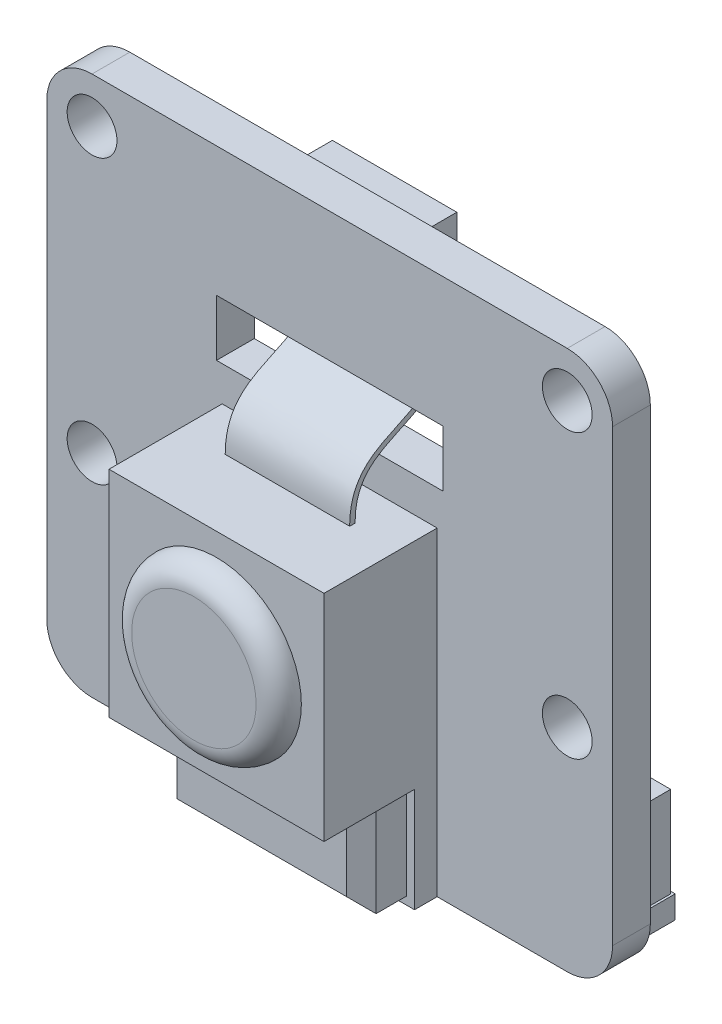
from build123d import *

# Parameters (mm, degrees)
SKETCH1_R                = 1.1
SKETCH1_W                = 10
SKETCH1_H                = 2.49
BOSS_EXTRUDE1_DEPTH      = 1.67
SKETCH2_W                = 9.5
SKETCH2_H                = 9.5
BOSS_EXTRUDE2_DEPTH      = 5
SKETCH3_R                = 3.75
BOSS_EXTRUDE3_DEPTH      = 1
FILLET1_R                = 1
SKETCH4_W                = 9.5
SKETCH4_H                = 4.61
BOSS_EXTRUDE4_DEPTH      = 1
SKETCH5_W                = 8.8
SKETCH5_H                = 3.91
BOSS_EXTRUDE5_DEPTH      = 2
CHAMFER1_SIZE            = 0.65
BOSS_EXTRUDE6_DEPTH      = 2.75
BOSS_EXTRUDE6_DEPTH_BACK = 2.75
SKETCH7_W                = 22
SKETCH7_H                = 1
BOSS_EXTRUDE7_DEPTH      = 2.6
SKETCH9_W                = 21.8
SKETCH9_H                = 4
BOSS_EXTRUDE8_DEPTH      = 2.5


with BuildPart() as part:
    # Sketch1 → Boss-Extrude1 (new body)
    with BuildSketch(Plane.XY):
        with BuildLine():
            Line((-10.5, -11.93), (10.5, -11.93))
            ThreePointArc((10.5, -11.93), (11.914213562, -11.344213562), (12.5, -9.93))
            Line((12.5, -9.93), (12.5, 9.93))
            ThreePointArc((12.5, 9.93), (11.914213562, 11.344213562), (10.5, 11.93))
            Line((10.5, 11.93), (-10.5, 11.93))
            ThreePointArc((-10.5, 11.93), (-11.914213562, 11.344213562), (-12.5, 9.93))
            Line((-12.5, 9.93), (-12.5, -9.93))
            ThreePointArc((-12.5, -9.93), (-11.914213562, -11.344213562), (-10.5, -11.93))
        make_face()
        with Locations((-10.5, 9.93)):
            Circle(SKETCH1_R, mode=Mode.SUBTRACT)
        with Locations((10.5, 9.93)):
            Circle(SKETCH1_R, mode=Mode.SUBTRACT)
        with Locations((-10.5, -2.57)):
            Circle(SKETCH1_R, mode=Mode.SUBTRACT)
        with Locations((10.5, -2.57)):
            Circle(SKETCH1_R, mode=Mode.SUBTRACT)
        with Locations((0, 4.965)):
            Rectangle(SKETCH1_W, SKETCH1_H, mode=Mode.SUBTRACT)
    extrude(amount=BOSS_EXTRUDE1_DEPTH)

    # Sketch2 → Boss-Extrude2 (add)
    with BuildSketch(Plane.XY.offset(1.67)):
        with Locations((0, -2.57)):
            Rectangle(SKETCH2_W, SKETCH2_H)
    extrude(amount=BOSS_EXTRUDE2_DEPTH)

    # Sketch3 → Boss-Extrude3 (add)
    with BuildSketch(Plane.XY.offset(6.67)):
        with Locations((0, -2.57)):
            Circle(SKETCH3_R)
    extrude(amount=BOSS_EXTRUDE3_DEPTH)

    # Fillet1
    fillet1_edges = [part.edges().sort_by_distance(p)[0] for p in [
        (-3.75, -2.57, 7.67),
    ]]
    fillet(fillet1_edges, radius=FILLET1_R - 0.0001)  # a hair under: the kernel refuses the full size

    # Sketch4 → Boss-Extrude4 (add)
    with BuildSketch(Plane.XY.offset(1.67)):
        with Locations((0, -9.625)):
            Rectangle(SKETCH4_W, SKETCH4_H)
    extrude(amount=BOSS_EXTRUDE4_DEPTH)

    # Sketch5 → Boss-Extrude5 (add)
    with BuildSketch(Plane.XY.offset(2.67)):
        with Locations((0, -9.625)):
            Rectangle(SKETCH5_W, SKETCH5_H)
    extrude(amount=BOSS_EXTRUDE5_DEPTH)

    # Chamfer1
    chamfer1_edges = [part.edges().sort_by_distance(p)[0] for p in [
        (4.4, -9.625, 4.67),
        (0, -7.67, 4.67),
        (-4.4, -9.625, 4.67),
        (0, -11.58, 4.67),
    ]]
    chamfer(chamfer1_edges, length=CHAMFER1_SIZE)

    # Sketch6 → Boss-Extrude6 (add, two sides: drawn at the far end of the back side and taken through both)
    with BuildSketch(Plane(origin=(0, 0, 0), x_dir=(0, 0, -1), z_dir=(1, 0, 0)).offset(-BOSS_EXTRUDE6_DEPTH_BACK)):
        with BuildLine():
            Line((-3.298312235, 2.18), (-3.534834551, 2.18))
            add(Edge.make_bspline(
                [(-3.534834551, 2.18), (-3.534834551, 4.944931667), (-0.47055609, 4.534187875), (0.730328755, 6.849182289), (0.79246314, 7.291776262), (0.79246314, 7.33)],
                knots=[0, 0, 0, 0, 0.784106591, 0.986086671, 1, 1, 1, 1], degree=3))
            Line((0.79246314, 7.33), (0, 7.33))
            Line((0, 7.33), (0, 11.83))
            Line((0, 11.83), (1.2, 11.83))
            Line((1.2, 11.83), (1.2, 7.33))
            Line((1.2, 7.33), (1.028985456, 7.33))
            add(Edge.make_bspline(
                [(-3.298312235, 2.18), (-3.298312235, 2.369708531), (-3.268931161, 2.774833109), (-3.111748266, 3.367193807), (-2.767956088, 3.909628415), (-2.161529025, 4.362480865), (-1.410396471, 4.725696596), (-0.605704822, 5.099255509), (0.165819225, 5.601384629), (0.682287807, 6.265090703), (0.910091228, 6.771630764), (0.98633259, 7.041505733), (1.014862156, 7.172550739), (1.028985456, 7.28085491), (1.028985456, 7.33)],
                knots=[0, 0, 0, 0, 0.0625, 0.125, 0.25, 0.375, 0.5, 0.625, 0.75, 0.875, 0.9375, 0.96875, 0.984375, 1, 1, 1, 1], degree=3))
        make_face()
    extrude(amount=BOSS_EXTRUDE6_DEPTH + BOSS_EXTRUDE6_DEPTH_BACK)

    # Sketch7 → Boss-Extrude7 (add)
    with BuildSketch(Plane(origin=(0, 0, 0), x_dir=(-1, 0, 0), z_dir=(0, 0, -1))):
        with Locations((0, -11.33)):
            Rectangle(SKETCH7_W, SKETCH7_H)
    extrude(amount=BOSS_EXTRUDE7_DEPTH)

    # Sketch9 → Boss-Extrude8 (add)
    with BuildSketch(Plane(origin=(0, 0, 0), x_dir=(-1, 0, 0), z_dir=(0, 0, -1))):
        with Locations((0, -8.83)):
            Rectangle(SKETCH9_W, SKETCH9_H)
    extrude(amount=BOSS_EXTRUDE8_DEPTH)


solid = part.part
